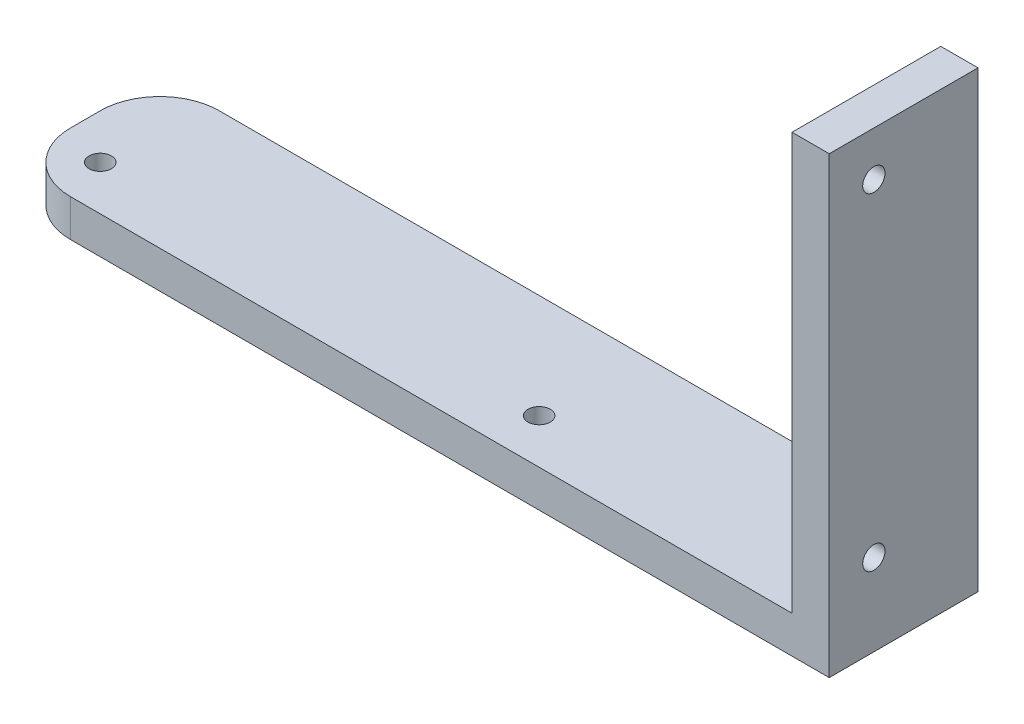
from build123d import *

# Parameters (mm, degrees)
SKETCH1_W           = 110
SKETCH1_H           = 20
BOSS_EXTRUDE1_DEPTH = 5
SKETCH2_W           = 5
SKETCH2_H           = 20
BOSS_EXTRUDE2_DEPTH = 56
SKETCH3_R           = 1.5
CUT_EXTRUDE1_DEPTH  = 126.043992259
FILLET1_R           = 8
SKETCH4_R           = 1.5
CUT_EXTRUDE2_DEPTH  = 124.069086289


with BuildPart() as part:
    # Sketch1 → Boss-Extrude1 (new body)
    with BuildSketch(Plane(origin=(0, 0, 0), x_dir=(1, 0, 0), z_dir=(0, 1, 0))):
        with Locations((55, 10)):
            Rectangle(SKETCH1_W, SKETCH1_H)
    extrude(amount=BOSS_EXTRUDE1_DEPTH)

    # Sketch2 → Boss-Extrude2 (add)
    with BuildSketch(Plane(origin=(0, 5, 0), x_dir=(1, 0, 0), z_dir=(0, 1, 0))):
        with Locations((107.5, 10)):
            Rectangle(SKETCH2_W, SKETCH2_H)
    extrude(amount=BOSS_EXTRUDE2_DEPTH)

    # Sketch3 → Cut-Extrude1 (cut, through all)
    with BuildSketch(Plane(origin=(0, 5, 0), x_dir=(1, 0, 0), z_dir=(0, 1, 0))):
        with Locations((6, 6)):
            Circle(SKETCH3_R)
        with Locations((65, 6)):
            Circle(SKETCH3_R)
    extrude(amount=-CUT_EXTRUDE1_DEPTH, mode=Mode.SUBTRACT)

    # Fillet1
    fillet1_edges = [part.edges().sort_by_distance(p)[0] for p in [
        (0, 2.5, 0),
        (0, 2.5, -20),
    ]]
    fillet(fillet1_edges, radius=FILLET1_R)

    # Sketch4 → Cut-Extrude2 (cut, through all)
    with BuildSketch(Plane.ZY.offset(-105)):
        with Locations((-6, 11)):
            Circle(SKETCH4_R)
        with Locations((-6, 55)):
            Circle(SKETCH4_R)
    extrude(amount=-CUT_EXTRUDE2_DEPTH, mode=Mode.SUBTRACT)


solid = part.part
